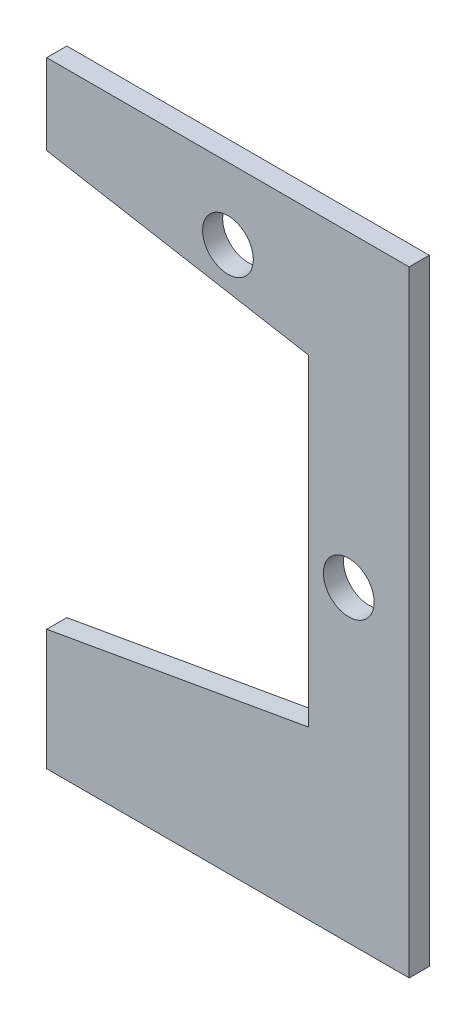
from build123d import *

# Parameters (mm, degrees)
ESQUISSE1_R        = 6.3
BOSS_EXTRU_1_DEPTH = 5


with BuildPart() as part:
    # Esquisse1 → Boss.-Extru.1 (new body)
    with BuildSketch(Plane.XY):
        Polygon((-65, 51.461253746), (0, 40), (0, -40), (-65, -51.461253746), (-65, -81.461253746), (25, -81.461253746), (25, 71.461253746), (-65, 71.461253746), align=None)
        with Locations((-20, 53.680805733)):
            Circle(ESQUISSE1_R, mode=Mode.SUBTRACT)
        with Locations((10, -5)):
            Circle(ESQUISSE1_R, mode=Mode.SUBTRACT)
    extrude(amount=BOSS_EXTRU_1_DEPTH)


solid = part.part
